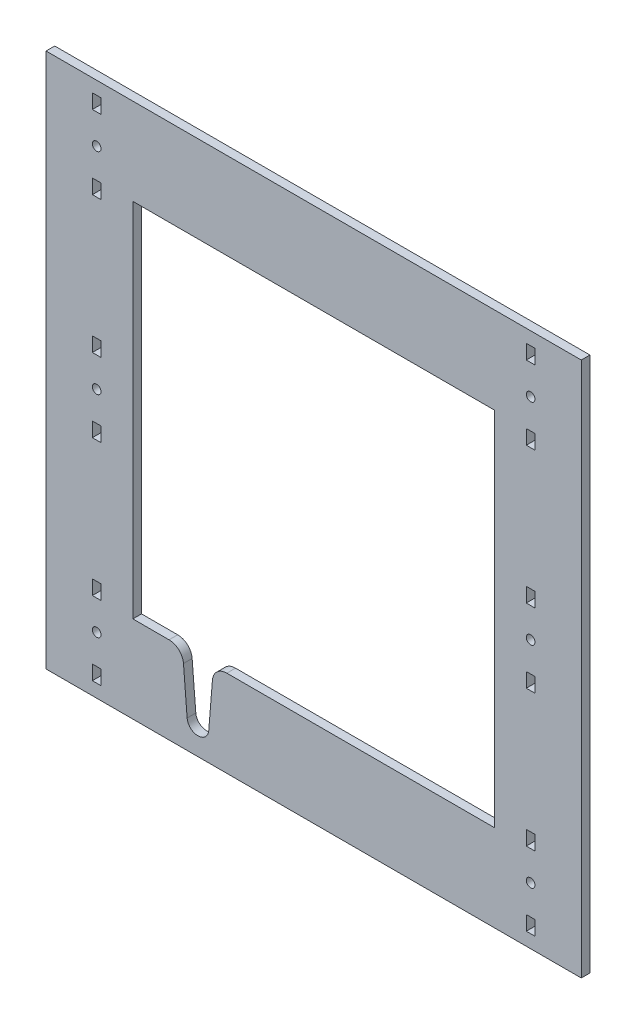
from build123d import *

# Parameters (mm, degrees)
SKETCH1_W           = 370
SKETCH1_H           = 370
SKETCH1_R           = 3
SKETCH1_W_2         = 6
SKETCH1_H_2         = 10
BOSS_EXTRUDE1_DEPTH = 3


with BuildPart() as part:
    # Sketch1 → Boss-Extrude1 (new, symmetric)
    with BuildSketch(Plane.XY):
        Rectangle(SKETCH1_W, SKETCH1_H)
        with Locations((-150, 145.5)):
            Circle(SKETCH1_R, mode=Mode.SUBTRACT)
        with Locations((-150, 0)):
            Circle(SKETCH1_R, mode=Mode.SUBTRACT)
        with Locations((-150, -145.5)):
            Circle(SKETCH1_R, mode=Mode.SUBTRACT)
        with Locations((150, -145.5)):
            Circle(SKETCH1_R, mode=Mode.SUBTRACT)
        with Locations((150, 0)):
            Circle(SKETCH1_R, mode=Mode.SUBTRACT)
        with Locations((150, 145.5)):
            Circle(SKETCH1_R, mode=Mode.SUBTRACT)
        with BuildLine():
            Line((-125, 125), (125, 125))
            Line((125, 125), (125, -125))
            Line((125, -125), (-60.032149237, -125))
            ThreePointArc((-60.032149237, -125), (-66.814030042, -127.651116225), (-70, -134.198781451))
            Line((-70, -134.198781451), (-72.524111928, -165.600913912))
            ThreePointArc((-72.524111928, -165.600913912), (-80, -172.5), (-87.475888072, -165.600913912))
            Line((-87.475888072, -165.600913912), (-90, -134.198781451))
            ThreePointArc((-90, -134.198781451), (-93.185969958, -127.651116225), (-99.967850763, -125))
            Line((-99.967850763, -125), (-125, -125))
            Line((-125, -125), (-125, 125))
        make_face(mode=Mode.SUBTRACT)
        with Locations((-150, 171)):
            Rectangle(SKETCH1_W_2, SKETCH1_H_2, mode=Mode.SUBTRACT)
        with Locations((-150, 120)):
            Rectangle(SKETCH1_W_2, SKETCH1_H_2, mode=Mode.SUBTRACT)
        with Locations((-150, 25.5)):
            Rectangle(SKETCH1_W_2, SKETCH1_H_2, mode=Mode.SUBTRACT)
        with Locations((-150, -25.5)):
            Rectangle(SKETCH1_W_2, SKETCH1_H_2, mode=Mode.SUBTRACT)
        with Locations((-150, -120)):
            Rectangle(SKETCH1_W_2, SKETCH1_H_2, mode=Mode.SUBTRACT)
        with Locations((-150, -171)):
            Rectangle(SKETCH1_W_2, SKETCH1_H_2, mode=Mode.SUBTRACT)
        with Locations((150, -171)):
            Rectangle(SKETCH1_W_2, SKETCH1_H_2, mode=Mode.SUBTRACT)
        with Locations((150, -120)):
            Rectangle(SKETCH1_W_2, SKETCH1_H_2, mode=Mode.SUBTRACT)
        with Locations((150, -25.5)):
            Rectangle(SKETCH1_W_2, SKETCH1_H_2, mode=Mode.SUBTRACT)
        with Locations((150, 25.5)):
            Rectangle(SKETCH1_W_2, SKETCH1_H_2, mode=Mode.SUBTRACT)
        with Locations((150, 120)):
            Rectangle(SKETCH1_W_2, SKETCH1_H_2, mode=Mode.SUBTRACT)
        with Locations((150, 171)):
            Rectangle(SKETCH1_W_2, SKETCH1_H_2, mode=Mode.SUBTRACT)
    extrude(amount=BOSS_EXTRUDE1_DEPTH, both=True)


solid = part.part
